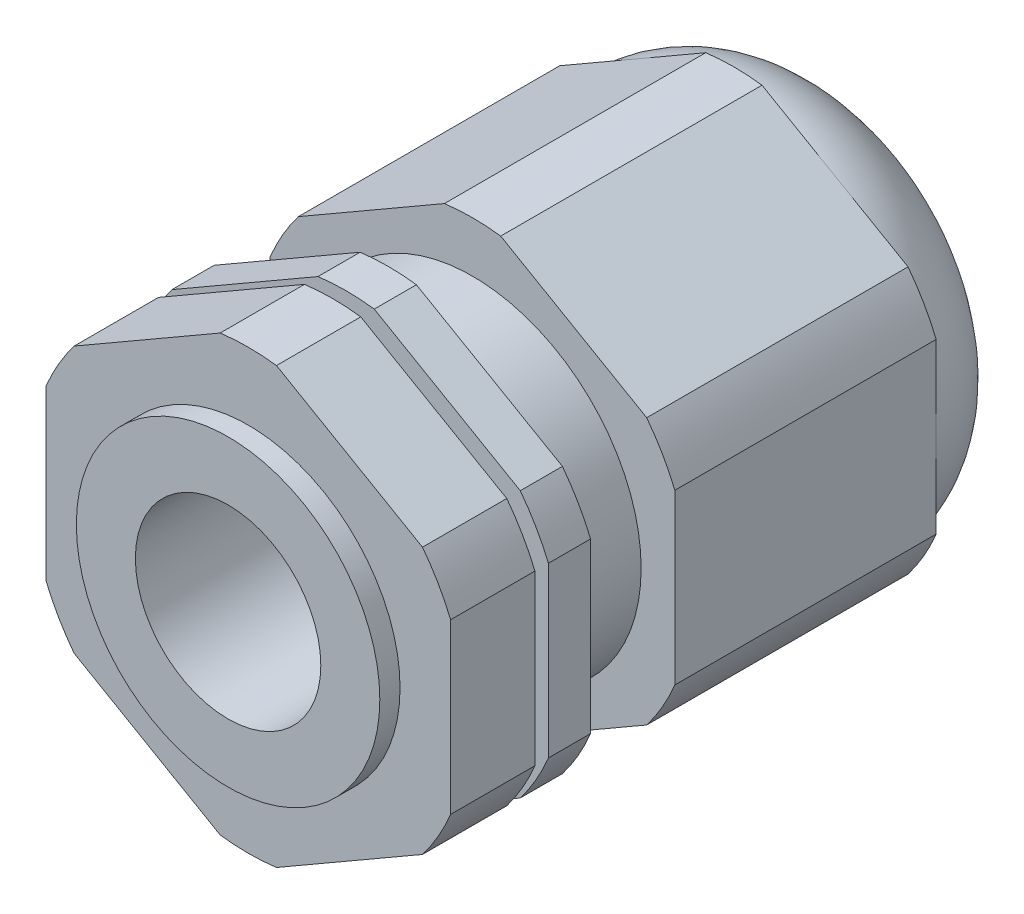
from build123d import *

# Parameters (mm, degrees)
SKETCH2_OUTSIDE_W  = 38.292
SKETCH2_OUTSIDE_H  = 38.292
CUT_EXTRUDE1_DEPTH = 40.357845469
SKETCH3_W          = 4
SKETCH3_H          = 5


with BuildPart() as part:
    # Sketch1 → Revolve1 (revolve)
    with BuildSketch(Plane(origin=(0, 0, 0), x_dir=(0, 0, -1), z_dir=(1, 0, 0))):
        Polygon((-7, 9), (-5.8, 9), (-5.8, 13), (-0.8, 13), (-0.8, 9), (0, 9), (0, 13), (29, 13), (29, 5.5), (-7, 5.5), align=None)
    revolve(axis=Axis((0, 0, 7), (0, 0, -1)))

    # Sketch2 outside → Cut-Extrude1 (cut, through all)
    with BuildSketch(Plane.XY.offset(5.8)):
        Rectangle(SKETCH2_OUTSIDE_W, SKETCH2_OUTSIDE_H)
        Polygon((0, 13.856406461), (-12, 6.92820323), (-12, -6.92820323), (0, -13.856406461), (12, -6.92820323), (12, 6.92820323), align=None, mode=Mode.SUBTRACT)
    extrude(amount=-CUT_EXTRUDE1_DEPTH, mode=Mode.SUBTRACT)

    # Sketch3 → Cut-Revolve3 (revolve, cut)
    with BuildSketch(Plane(origin=(0, 0, 0), x_dir=(1, 0, 0), z_dir=(0, 1, 0))):
        with BuildLine():
            Line((-6, 29), (-6, 34))
            Line((-6, 34), (-61.446878064, 34))
            Line((-61.446878064, 34), (-61.446878064, 23))
            Line((-61.446878064, 23), (-12, 23))
            ThreePointArc((-12, 23), (-10.242640687, 27.242640687), (-6, 29))
        make_face()
        with Locations((-12, 5)):
            Rectangle(SKETCH3_W, SKETCH3_H)
    revolve(axis=Axis((0, 0, -29), (0, 0, 1)), mode=Mode.SUBTRACT)


solid = part.part
